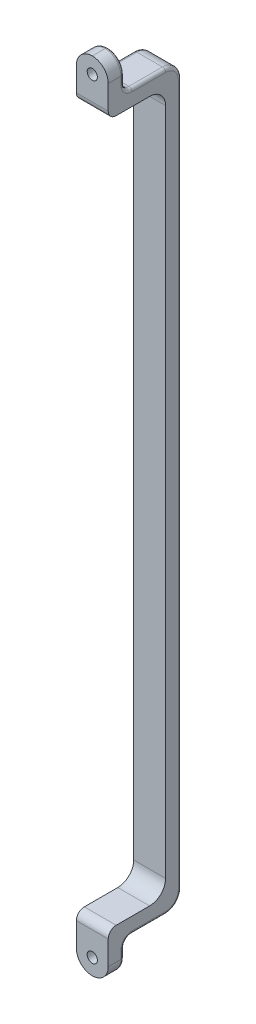
from build123d import *

# Parameters (mm, degrees)
BOSS_EXTRUDE1_DEPTH = 5
BOSS_EXTRUDE2_DEPTH = 18
SKETCH3_W           = 9.999999999999972
SKETCH3_H           = 10
BOSS_EXTRUDE3_DEPTH = 5
SKETCH4_R           = 1.5999999999999999
SKETCH4_R_2         = 1.599999999999992
CUT_EXTRUDE1_DEPTH  = 241.88171371027735
SKETCH5_R           = 2.5000000000000004
SKETCH5_R_2         = 2.500000000000001
CUT_EXTRUDE2_DEPTH  = 1.5
FILLET1_R           = 5
FILLET2_R           = 2.5
FILLET3_R           = 1


with BuildPart() as part:
    # Sketch1 → Boss-Extrude1 (new body)
    with BuildSketch(Plane.XY):
        Polygon((0, 0), (0, 230), (9.999999999999972, 230), (10, -7.8e-16), align=None)
    extrude(amount=BOSS_EXTRUDE1_DEPTH)

    # Sketch2 → Boss-Extrude2 (add)
    with BuildSketch(Plane.XY.offset(5)):
        Polygon((0, 0), (10, -7.8e-16), (10, 4.999999999999999), (0, 5.000000000000004), align=None)
        Polygon((0, 230), (9.999999999999972, 230), (10, 225), (0, 225), align=None)
    extrude(amount=BOSS_EXTRUDE2_DEPTH)

    # Sketch3 → Boss-Extrude3 (add)
    with BuildSketch(Plane.XY.offset(23)):
        with Locations((4.999999999999986, 235.00000000000003)):
            Rectangle(SKETCH3_W, SKETCH3_H)
        Polygon((0, 0), (10, -7.8e-16), (10.000000000000002, -10), (0, -10.000000000000002), align=None)
    extrude(amount=-BOSS_EXTRUDE3_DEPTH)

    # Sketch4 → Cut-Extrude1 (cut, through all)
    with BuildSketch(Plane(origin=(0, 0, 18), x_dir=(-1, 0, 0), z_dir=(0, 0, -1))):
        with Locations((-5, -5.000000000000002)):
            Circle(SKETCH4_R)
        with Locations((-5, 235.00000000000003)):
            Circle(SKETCH4_R_2)
    extrude(amount=-CUT_EXTRUDE1_DEPTH, mode=Mode.SUBTRACT)

    # Sketch5 → Cut-Extrude2 (cut)
    with BuildSketch(Plane(origin=(0, 0, 18), x_dir=(-1, 0, 0), z_dir=(0, 0, -1))):
        with Locations((-5, -5.000000000000002)):
            Circle(SKETCH5_R)
        with Locations((-5, 235.00000000000003)):
            Circle(SKETCH5_R_2)
    extrude(amount=-CUT_EXTRUDE2_DEPTH, mode=Mode.SUBTRACT)

    # Fillet1
    fillet1_edges = [part.edges().sort_by_distance(p)[0] for p in [
        (0, -10.000000000000002, 20.5),
        (10.000000000000002, -10, 20.5),
        (0, 240.00000000000003, 20.5),
        (9.999999999999972, 240.00000000000003, 20.5),
        (5, 225, 5),
        (4.999999999999986, 230, 0),
        (5, 5.000000000000002, 5),
        (5, -3.9e-16, 0),
    ]]
    fillet(fillet1_edges, radius=FILLET1_R - 0.0001)  # a hair under: the kernel refuses the full size

    # Fillet2
    fillet2_edges = [part.edges().sort_by_distance(p)[0] for p in [
        (5, 5.000000000000002, 23),
        (5, 225, 23),
        (4.999999999999986, 230, 18),
        (5, -3.9e-16, 18),
    ]]
    fillet(fillet2_edges, radius=FILLET2_R)

    # Fillet3
    fillet3_edges = [part.edges().sort_by_distance(p)[0] for p in [
        (0, 115, 0),
        (0, 233.75005000000002, 18),
        (-2.7e-16, 1.4644368047453802, 1.4644368047453806),
        (0, 228.5355631952546, 1.4644368047453806),
        (10, -3.7500500000000008, 18),
        (8.53556319525462, -8.535563195254621, 18),
        (1.464436804745381, -8.53556319525462, 18),
        (9.999999999999986, 115, 0),
        (10, 1.4644368047453793, 1.4644368047453806),
        (9.999999999999972, 228.5355631952546, 1.4644368047453806),
        (8.53556319525459, 238.53556319525464, 18),
        (1.4644368047453793, 238.53556319525464, 18),
        (10, -7.8e-16, 10.249949999999998),
        (9.999999999999972, 230, 10.24995),
        (9.999999999999972, 233.75005000000002, 18),
        (0, -3.75005, 18),
        (0, 230, 10.24995),
        (0, 0, 10.249949999999998),
        (9.999999999999972, 230.73223304703362, 17.26776695296637),
        (0, 230.73223304703362, 17.26776695296637),
        (1.4e-16, -0.7322330470336309, 17.26776695296637),
        (10, -0.7322330470336316, 17.26776695296637),
    ]]
    fillet(fillet3_edges, radius=FILLET3_R)


solid = part.part
